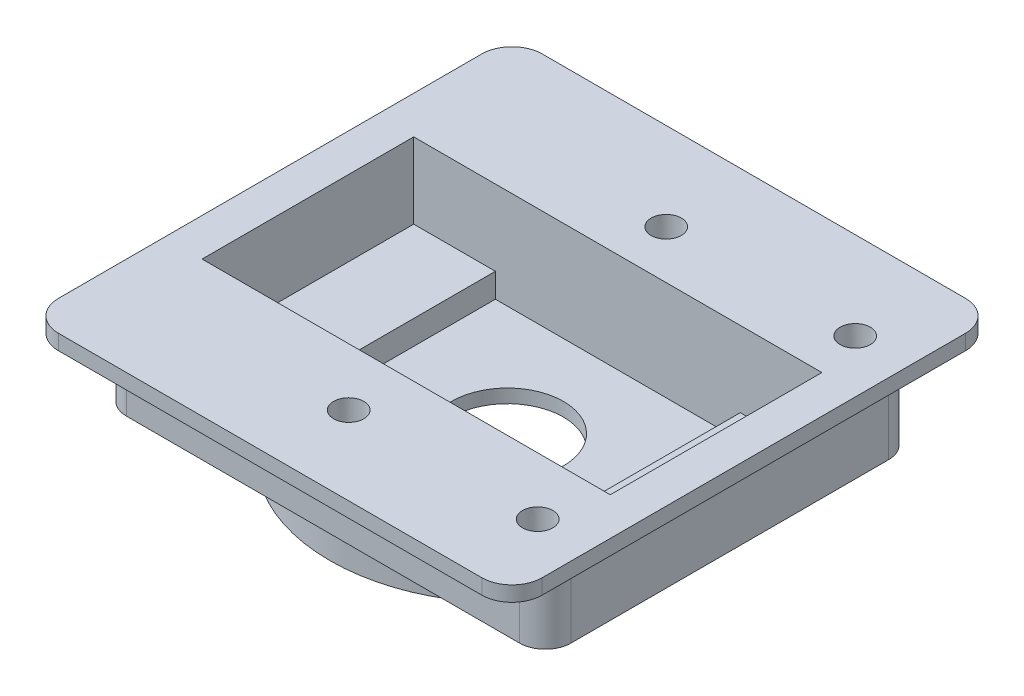
from build123d import *

# Parameters (mm, degrees)
SKETCH_1_W                    = 32
SKETCH_1_H                    = 32
EXTRUDE_1_DEPTH               = 1
EXTRUDE_2_DEPTH               = 5
SKETCH_2_W                    = 27
SKETCH_2_H                    = 14
CUT_EXTRUDE_1_DEPTH           = 5
SKETCH_4_R                    = 11.747624997
EXTRUDE_3_DEPTH               = 2
SKETCH_5_R                    = 4.75
CUT_EXTRUDE_2_DEPTH           = 0.5
CUT_EXTRUDE_2_DRAFT           = -37
SKETCH_6_R                    = 3.7
CUT_EXTRUDE_3_DEPTH           = 54.739676092
FILLET_1_R                    = 2
SKETCH_7_R                    = 1
CUT_EXTRUDE_4_DEPTH           = 4
CUT_EXTRUDE_4_DRAFT           = -2
CUT_EXTRUDE_4_PROFILE_2_DEPTH = 4
CUT_EXTRUDE_4_PROFILE_2_DRAFT = -2
CUT_EXTRUDE_4_PROFILE_3_DEPTH = 4
CUT_EXTRUDE_4_PROFILE_3_DRAFT = -2
CUT_EXTRUDE_4_PROFILE_4_DEPTH = 4
CUT_EXTRUDE_4_PROFILE_4_DRAFT = -2
SKETCH_8_W                    = 16.2
SKETCH_8_H                    = 14
CUT_EXTRUDE_5_DEPTH           = 1.6


with BuildPart() as part:
    # 草图1 → 凸台-拉伸1 (new body)
    with BuildSketch(Plane(origin=(0, 0, 0), x_dir=(1, 0, 0), z_dir=(0, 1, 0))):
        with Locations((-24.552631543, -18.455578089)):
            Rectangle(SKETCH_1_W, SKETCH_1_H)
    extrude(amount=EXTRUDE_1_DEPTH)

    # 草图3 → 凸台-拉伸2 (add)
    with BuildSketch(Plane.XZ):
        with BuildLine():
            Line((-9.852631543, 8.255578089), (-9.852631543, 29.255578089))
            ThreePointArc((-9.852631543, 29.255578089), (-10.350550015, 30.457659617), (-11.552631543, 30.955578089))
            Line((-11.552631543, 30.955578089), (-37.552631543, 30.955578089))
            ThreePointArc((-37.552631543, 30.955578089), (-38.754713071, 30.457659617), (-39.252631543, 29.255578089))
            Line((-39.252631543, 29.255578089), (-39.252631543, 8.255578089))
            ThreePointArc((-39.252631543, 8.255578089), (-38.754713071, 7.053496561), (-37.552631543, 6.555578089))
            Line((-37.552631543, 6.555578089), (-11.552631543, 6.555578089))
            ThreePointArc((-11.552631543, 6.555578089), (-10.350550015, 7.053496561), (-9.852631543, 8.255578089))
        make_face()
    extrude(amount=EXTRUDE_2_DEPTH)

    # 草图2 → 切除-拉伸1 (cut)
    with BuildSketch(Plane(origin=(0, 1, 0), x_dir=(1, 0, 0), z_dir=(0, 1, 0))):
        with Locations((-24.552631543, -18.455578089)):
            Rectangle(SKETCH_2_W, SKETCH_2_H)
    extrude(amount=-CUT_EXTRUDE_1_DEPTH, mode=Mode.SUBTRACT)

    # 草图4 → 凸台-拉伸3 (add)
    with BuildSketch(Plane.XZ.offset(5)):
        with Locations((-24.552631543, 18.755578089)):
            Circle(SKETCH_4_R)
    extrude(amount=EXTRUDE_3_DEPTH)


with BuildPart() as cut_extrude_2_tool:
    # 草图5 → 切除-拉伸2 (with draft: the straight prism first)
    with BuildSketch(Plane.XZ.offset(7)):
        with Locations((-24.552631543, 18.755578089)):
            Circle(SKETCH_5_R)
    extrude(amount=-CUT_EXTRUDE_2_DEPTH)
    # 切除-拉伸2: the draft: its side faces are tilted about the plane it starts from
    cut_extrude_2_sides = [cut_extrude_2_tool.faces().sort_by_distance(p)[0] for p in [
        (-29.302631543, -6.75, 18.755578089),
    ]]
    draft(cut_extrude_2_sides, Plane.XZ.offset(7), CUT_EXTRUDE_2_DRAFT)


with BuildPart() as part_1:
    add(part.part)

    # 切除-拉伸2: cut by cut_extrude_2_tool
    add(cut_extrude_2_tool.part, mode=Mode.SUBTRACT)

    # 草图6 → 切除-拉伸3 (cut, through all)
    with BuildSketch(Plane.XZ.offset(6.5)):
        with Locations((-24.552631543, 18.755578089)):
            Circle(SKETCH_6_R)
    extrude(amount=-CUT_EXTRUDE_3_DEPTH, mode=Mode.SUBTRACT)

    # 圆角1
    fillet_1_edges = [part_1.edges().sort_by_distance(p)[0] for p in [
        (-40.552631543, 0.5, 2.455578089),
        (-8.552631543, 0.5, 2.455578089),
        (-40.552631543, 0.5, 34.455578089),
        (-8.552631543, 0.5, 34.455578089),
    ]]
    fillet(fillet_1_edges, radius=FILLET_1_R)


with BuildPart() as cut_extrude_4_tool:
    # 草图7 → 切除-拉伸4 (with draft: the straight prism first)
    with BuildSketch(Plane(origin=(0, 1, 0), x_dir=(1, 0, 0), z_dir=(0, 1, 0))):
        with Locations((-24.552631543, -8.255578089)):
            Circle(SKETCH_7_R)
    extrude(amount=-CUT_EXTRUDE_4_DEPTH)
    # 切除-拉伸4: the draft: its side faces are tilted about the plane it starts from
    cut_extrude_4_sides = [cut_extrude_4_tool.faces().sort_by_distance(p)[0] for p in [
        (-25.552631543, -1, 8.255578089),
    ]]
    draft(cut_extrude_4_sides, Plane(origin=(0, 1, 0), x_dir=(1, 0, 0), z_dir=(0, 1, 0)), CUT_EXTRUDE_4_DRAFT)


with BuildPart() as part_2:
    add(part_1.part)

    # 切除-拉伸4: cut by cut_extrude_4_tool
    add(cut_extrude_4_tool.part, mode=Mode.SUBTRACT)


with BuildPart() as cut_extrude_4_profile_2_tool:
    # 草图7 → 切除-拉伸4 profile 2 (with draft: the straight prism first)
    with BuildSketch(Plane(origin=(0, 1, 0), x_dir=(1, 0, 0), z_dir=(0, 1, 0))):
        with Locations((-12.052631543, -8.255578089)):
            Circle(SKETCH_7_R)
    extrude(amount=-CUT_EXTRUDE_4_PROFILE_2_DEPTH)
    # 切除-拉伸4 profile 2: the draft: its side faces are tilted about the plane it starts from
    cut_extrude_4_profile_2_sides = [cut_extrude_4_profile_2_tool.faces().sort_by_distance(p)[0] for p in [
        (-13.052631543, -1, 8.255578089),
    ]]
    draft(cut_extrude_4_profile_2_sides, Plane(origin=(0, 1, 0), x_dir=(1, 0, 0), z_dir=(0, 1, 0)), CUT_EXTRUDE_4_PROFILE_2_DRAFT)


with BuildPart() as part_3:
    add(part_2.part)

    # 切除-拉伸4 profile 2: cut by cut_extrude_4_profile_2_tool
    add(cut_extrude_4_profile_2_tool.part, mode=Mode.SUBTRACT)


with BuildPart() as cut_extrude_4_profile_3_tool:
    # 草图7 → 切除-拉伸4 profile 3 (with draft: the straight prism first)
    with BuildSketch(Plane(origin=(0, 1, 0), x_dir=(1, 0, 0), z_dir=(0, 1, 0))):
        with Locations((-24.552631543, -29.255578089)):
            Circle(SKETCH_7_R)
    extrude(amount=-CUT_EXTRUDE_4_PROFILE_3_DEPTH)
    # 切除-拉伸4 profile 3: the draft: its side faces are tilted about the plane it starts from
    cut_extrude_4_profile_3_sides = [cut_extrude_4_profile_3_tool.faces().sort_by_distance(p)[0] for p in [
        (-25.552631543, -1, 29.255578089),
    ]]
    draft(cut_extrude_4_profile_3_sides, Plane(origin=(0, 1, 0), x_dir=(1, 0, 0), z_dir=(0, 1, 0)), CUT_EXTRUDE_4_PROFILE_3_DRAFT)


with BuildPart() as part_4:
    add(part_3.part)

    # 切除-拉伸4 profile 3: cut by cut_extrude_4_profile_3_tool
    add(cut_extrude_4_profile_3_tool.part, mode=Mode.SUBTRACT)


with BuildPart() as cut_extrude_4_profile_4_tool:
    # 草图7 → 切除-拉伸4 profile 4 (with draft: the straight prism first)
    with BuildSketch(Plane(origin=(0, 1, 0), x_dir=(1, 0, 0), z_dir=(0, 1, 0))):
        with Locations((-12.052631543, -29.255578089)):
            Circle(SKETCH_7_R)
    extrude(amount=-CUT_EXTRUDE_4_PROFILE_4_DEPTH)
    # 切除-拉伸4 profile 4: the draft: its side faces are tilted about the plane it starts from
    cut_extrude_4_profile_4_sides = [cut_extrude_4_profile_4_tool.faces().sort_by_distance(p)[0] for p in [
        (-13.052631543, -1, 29.255578089),
    ]]
    draft(cut_extrude_4_profile_4_sides, Plane(origin=(0, 1, 0), x_dir=(1, 0, 0), z_dir=(0, 1, 0)), CUT_EXTRUDE_4_PROFILE_4_DRAFT)


with BuildPart() as part_5:
    add(part_4.part)

    # 切除-拉伸4 profile 4: cut by cut_extrude_4_profile_4_tool
    add(cut_extrude_4_profile_4_tool.part, mode=Mode.SUBTRACT)

    # 草图8 → 切除-拉伸5 (cut)
    with BuildSketch(Plane(origin=(0, -4, 0), x_dir=(1, 0, 0), z_dir=(0, 1, 0))):
        with Locations((-24.552631543, -18.455578089)):
            Rectangle(SKETCH_8_W, SKETCH_8_H)
    extrude(amount=-CUT_EXTRUDE_5_DEPTH, mode=Mode.SUBTRACT)


solid = part_5.part
